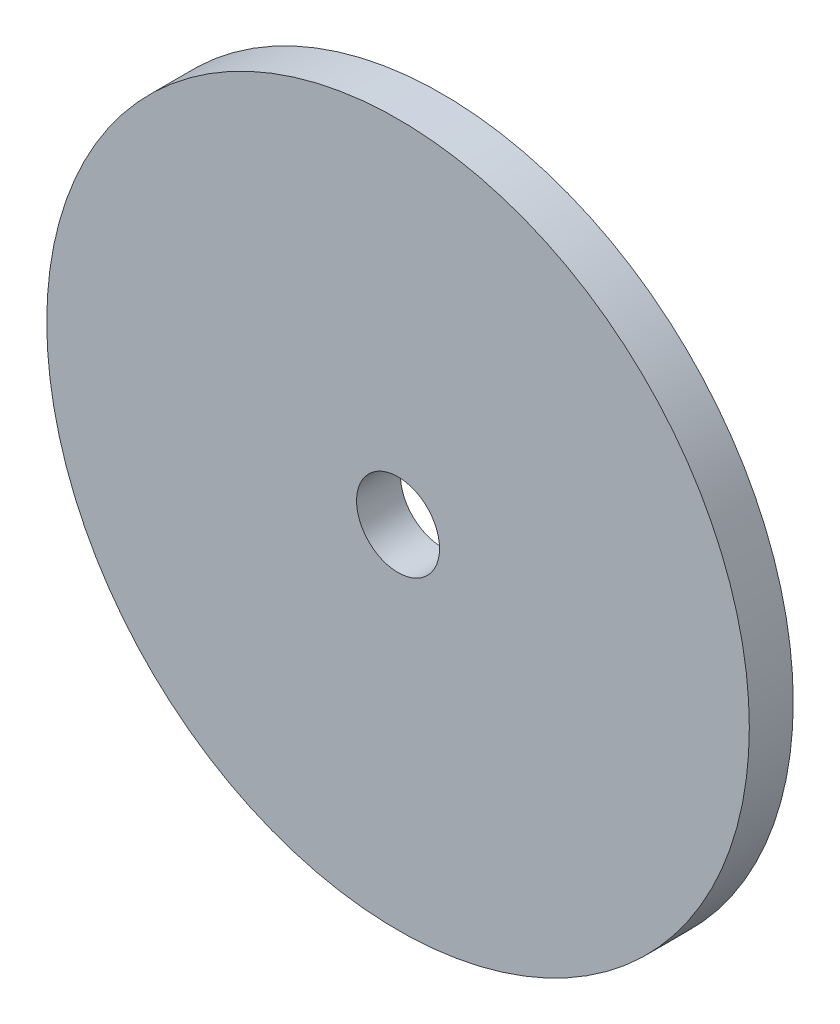
from build123d import *

# Parameters (mm, degrees)
SKETCH1_R           = 10.16
SKETCH1_R_2         = 1.2
BOSS_EXTRUDE1_DEPTH = 1.27
BOSS_EXTRUDE2_DEPTH = 1.27
CIRPATTERN1_COUNT   = 4


with BuildPart() as part:
    # Sketch1 → Boss-Extrude1 (new body)
    with BuildSketch(Plane.XY):
        Circle(SKETCH1_R)
        Circle(SKETCH1_R_2, mode=Mode.SUBTRACT)
    extrude(amount=BOSS_EXTRUDE1_DEPTH)

    # Sketch2 → Boss-Extrude2 (add)
    with BuildSketch(Plane(origin=(0, 0, 0), x_dir=(-1, 0, 0), z_dir=(0, 0, -1))):
        with BuildLine():
            Line((-1.524, 6.318815031), (-1.524, 7.588815031))
            Line((-1.524, 7.588815031), (1.524, 7.588815031))
            Line((1.524, 7.588815031), (1.524, 6.318815031))
            ThreePointArc((1.524, 6.318815031), (0, 6.499999954), (-1.524, 6.318815031))
        make_face()
    boss_extrude2 = extrude(amount=BOSS_EXTRUDE2_DEPTH)

    # CirPattern1: Boss-Extrude2 ×4 about axis
    cirpattern1_axis = Axis((0, 0, 1.27), (0, 0, -1))
    for i in range(1, CIRPATTERN1_COUNT):
        add(boss_extrude2.rotate(cirpattern1_axis, i * 360 / CIRPATTERN1_COUNT))


solid = part.part
